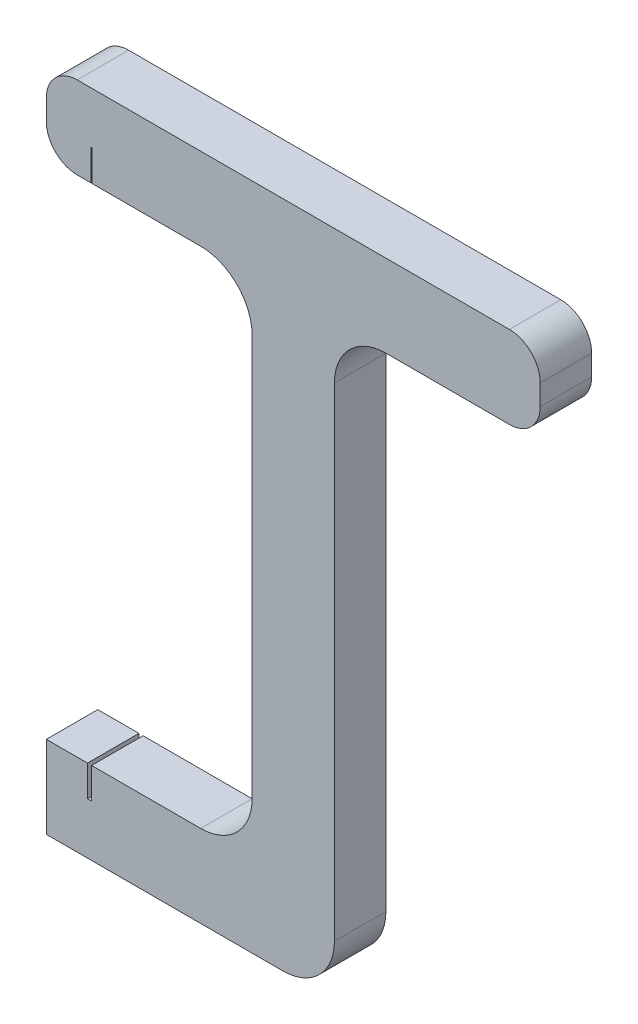
from build123d import *

# Parameters (mm, degrees)
BOSS_EXTRUDE1_DEPTH = 5
SKETCH2_W           = 0.4
SKETCH2_H           = 5
CUT_EXTRUDE1_DEPTH  = 3
SKETCH3_W           = 0.1
SKETCH3_H           = 5
CUT_EXTRUDE2_DEPTH  = 3
FILLET1_R           = 5
FILLET2_R           = 3


with BuildPart() as part:
    # Sketch1 → Boss-Extrude1 (new body)
    with BuildSketch(Plane.XY):
        Polygon((0, 65), (-28, 65), (-28, 57), (-8, 57), (-8, 8), (-28, 8), (-28, 0), (0, 0), (0, 57), (20, 57), (20, 65), align=None)
    extrude(amount=BOSS_EXTRUDE1_DEPTH)

    # Sketch2 → Cut-Extrude1 (cut)
    with BuildSketch(Plane(origin=(0, 8, 0), x_dir=(1, 0, 0), z_dir=(0, 1, 0))):
        with Locations((-23.8, -2.5)):
            Rectangle(SKETCH2_W, SKETCH2_H)
    extrude(amount=-CUT_EXTRUDE1_DEPTH, mode=Mode.SUBTRACT)

    # Sketch3 → Cut-Extrude2 (cut)
    with BuildSketch(Plane.XZ.offset(-57)):
        with Locations((-23.6, 2.5)):
            Rectangle(SKETCH3_W, SKETCH3_H)
    extrude(amount=-CUT_EXTRUDE2_DEPTH, mode=Mode.SUBTRACT)

    # Fillet1
    fillet1_edges = [part.edges().sort_by_distance(p)[0] for p in [
        (0, 57, 2.5),
        (-8, 57, 2.5),
        (0, 0, 2.5),
        (-8, 8, 2.5),
    ]]
    fillet(fillet1_edges, radius=FILLET1_R)

    # Fillet2
    fillet2_edges = [part.edges().sort_by_distance(p)[0] for p in [
        (-28, 57, 2.5),
        (20, 57, 2.5),
        (20, 65, 2.5),
        (-28, 65, 2.5),
    ]]
    fillet(fillet2_edges, radius=FILLET2_R)


solid = part.part
